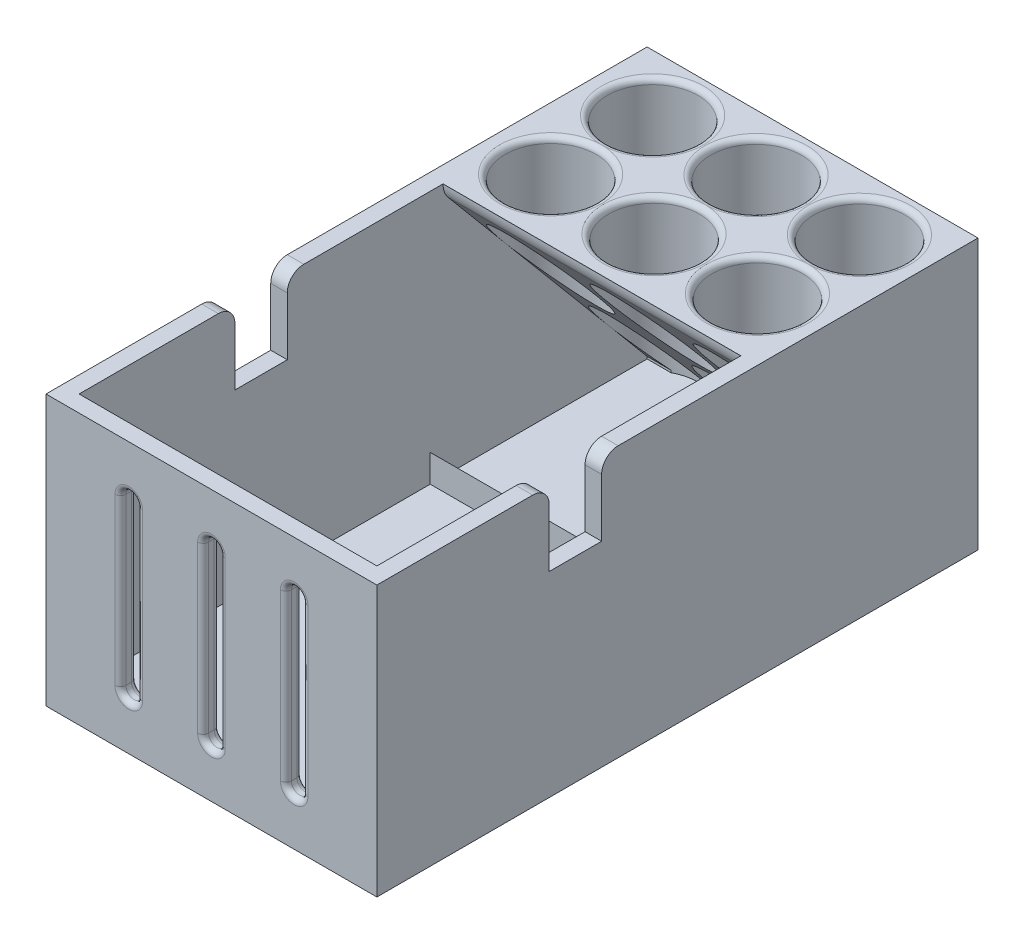
from build123d import *

# Parameters (mm, degrees)
BASE_PLATE_W              = 60
BASE_PLATE_H              = 106
BASE_DEPTH                = 3
SKETCH3_W                 = 3
SKETCH3_H                 = 106
BOSS_EXTRUDE2_DEPTH       = 46
SKETCH5_W                 = 54
SKETCH5_H                 = 3
BOSS_EXTRUDE3_DEPTH       = 46
SKETCH4_W                 = 54
SKETCH4_H                 = 37
BOSS_EXTRUDE4_DEPTH       = 1.5
BOSS_EXTRUDE5_DEPTH       = 54
CUT_EXTRUDE1_REACH        = 80.166
FLUXPENS_R                = 8.25
FILLET1_R                 = 1
FILLET2_R                 = 1
FILLET3_R                 = 1
FILLET4_R                 = 1
FILLET5_R                 = 1
FILLET6_R                 = 1
ROLLER_CUT_OUT_DEPTH      = 92.972822073
ROLLER_CUT_OUT_DEPTH_BACK = 92.972822073
SKETCH12_W                = 9.5
SKETCH12_H                = 13.5
SKETCH13_W                = 60
SKETCH13_H                = 49
BOSS_EXTRUDE6_DEPTH       = 3
CUT_EXTRUDE6_DEPTH        = 3
FILLET7_R                 = 1
FILLET8_R                 = 1
FILLET9_R                 = 1
FILLET10_R                = 3
FILLET11_R                = 3
FILLET12_R                = 3
FILLET13_R                = 3
FILLET14_R                = 4
FILLET15_R                = 1
FILLET16_R                = 1
FILLET17_R                = 1
TOOL_CATCHER_DEPTH        = 54


with BuildPart() as part:
    # Base Plate → Base (new body)
    with BuildSketch(Plane(origin=(0, 0, 0), x_dir=(1, 0, 0), z_dir=(0, 1, 0))):
        Rectangle(BASE_PLATE_W, BASE_PLATE_H)
    extrude(amount=BASE_DEPTH)

    # Sketch3 → Boss-Extrude2 (add)
    with BuildSketch(Plane(origin=(0, 3, 0), x_dir=(1, 0, 0), z_dir=(0, 1, 0))):
        with Locations((-28.5, 0)):
            Rectangle(SKETCH3_W, SKETCH3_H)
        with Locations((28.5, 0)):
            Rectangle(SKETCH3_W, SKETCH3_H)
    extrude(amount=BOSS_EXTRUDE2_DEPTH)

    # Sketch5 → Boss-Extrude3 (add)
    with BuildSketch(Plane(origin=(0, 3, 0), x_dir=(1, 0, 0), z_dir=(0, 1, 0))):
        with Locations((0, 51.5)):
            Rectangle(SKETCH5_W, SKETCH5_H)
    extrude(amount=BOSS_EXTRUDE3_DEPTH)

    # Sketch4 → Boss-Extrude4 (add)
    with BuildSketch(Plane(origin=(0, 49, 0), x_dir=(1, 0, 0), z_dir=(0, 1, 0))):
        with Locations((0, 31.5)):
            Rectangle(SKETCH4_W, SKETCH4_H)
    extrude(amount=-BOSS_EXTRUDE4_DEPTH)

    # Sketch7 → Boss-Extrude5 (add)
    with BuildSketch(Plane.ZY.offset(-27)):
        Polygon((-50, 47.5), (-13, 47.5), (-50, 3.405117074), align=None)
    extrude(amount=BOSS_EXTRUDE5_DEPTH)

    # Cut-Extrude1: up to this face of the body (flat: up to its plane)
    cut_extrude1_end = Plane(part.part.faces().sort_by_distance((0, 3, 1.5))[0])
    # FluxPens → Cut-Extrude1 (cut, up to the picked face)
    with BuildSketch(Plane(origin=(0, 49, 0), x_dir=(1, 0, 0), z_dir=(0, 1, 0)), mode=Mode.PRIVATE) as cut_extrude1_sk1:
        with Locations(Location((-18.75, 42.75, 0), (0, 0, 270))):
            Circle(FLUXPENS_R)
    cut_extrude1_tool1 = split(extrude(cut_extrude1_sk1.sketch, amount=-CUT_EXTRUDE1_REACH, mode=Mode.PRIVATE), bisect_by=cut_extrude1_end, keep=Keep.BOTH, mode=Mode.PRIVATE)
    # FluxPens → Cut-Extrude1 (cut, up to the picked face)
    with BuildSketch(Plane(origin=(0, 49, 0), x_dir=(1, 0, 0), z_dir=(0, 1, 0)), mode=Mode.PRIVATE) as cut_extrude1_sk2:
        with Locations(Location((-18.75, 24.25, 0), (0, 0, 270))):
            Circle(FLUXPENS_R)
    cut_extrude1_tool2 = split(extrude(cut_extrude1_sk2.sketch, amount=-CUT_EXTRUDE1_REACH, mode=Mode.PRIVATE), bisect_by=cut_extrude1_end, keep=Keep.BOTH, mode=Mode.PRIVATE)
    # FluxPens → Cut-Extrude1 (cut, up to the picked face)
    with BuildSketch(Plane(origin=(0, 49, 0), x_dir=(1, 0, 0), z_dir=(0, 1, 0)), mode=Mode.PRIVATE) as cut_extrude1_sk3:
        with Locations(Location((0, 42.75, 0), (0, 0, 270))):
            Circle(FLUXPENS_R)
    cut_extrude1_tool3 = split(extrude(cut_extrude1_sk3.sketch, amount=-CUT_EXTRUDE1_REACH, mode=Mode.PRIVATE), bisect_by=cut_extrude1_end, keep=Keep.BOTH, mode=Mode.PRIVATE)
    # FluxPens → Cut-Extrude1 (cut, up to the picked face)
    with BuildSketch(Plane(origin=(0, 49, 0), x_dir=(1, 0, 0), z_dir=(0, 1, 0)), mode=Mode.PRIVATE) as cut_extrude1_sk4:
        with Locations(Location((0, 24.25, 0), (0, 0, 270))):
            Circle(FLUXPENS_R)
    cut_extrude1_tool4 = split(extrude(cut_extrude1_sk4.sketch, amount=-CUT_EXTRUDE1_REACH, mode=Mode.PRIVATE), bisect_by=cut_extrude1_end, keep=Keep.BOTH, mode=Mode.PRIVATE)
    # FluxPens → Cut-Extrude1 (cut, up to the picked face)
    with BuildSketch(Plane(origin=(0, 49, 0), x_dir=(1, 0, 0), z_dir=(0, 1, 0)), mode=Mode.PRIVATE) as cut_extrude1_sk5:
        with Locations(Location((18.75, 24.25, 0), (0, 0, 270))):
            Circle(FLUXPENS_R)
    cut_extrude1_tool5 = split(extrude(cut_extrude1_sk5.sketch, amount=-CUT_EXTRUDE1_REACH, mode=Mode.PRIVATE), bisect_by=cut_extrude1_end, keep=Keep.BOTH, mode=Mode.PRIVATE)
    # FluxPens → Cut-Extrude1 (cut, up to the picked face)
    with BuildSketch(Plane(origin=(0, 49, 0), x_dir=(1, 0, 0), z_dir=(0, 1, 0)), mode=Mode.PRIVATE) as cut_extrude1_sk6:
        with Locations(Location((18.75, 42.75, 0), (0, 0, 270))):
            Circle(FLUXPENS_R)
    cut_extrude1_tool6 = split(extrude(cut_extrude1_sk6.sketch, amount=-CUT_EXTRUDE1_REACH, mode=Mode.PRIVATE), bisect_by=cut_extrude1_end, keep=Keep.BOTH, mode=Mode.PRIVATE)
    add(cut_extrude1_tool1.solids().sort_by(Axis((-18.75, 49, -42.75), (0, -1, 0)))[0], mode=Mode.SUBTRACT)
    add(cut_extrude1_tool2.solids().sort_by(Axis((-18.75, 49, -24.25), (0, -1, 0)))[0], mode=Mode.SUBTRACT)
    add(cut_extrude1_tool3.solids().sort_by(Axis((0, 49, -42.75), (0, -1, 0)))[0], mode=Mode.SUBTRACT)
    add(cut_extrude1_tool4.solids().sort_by(Axis((0, 49, -24.25), (0, -1, 0)))[0], mode=Mode.SUBTRACT)
    add(cut_extrude1_tool5.solids().sort_by(Axis((18.75, 49, -24.25), (0, -1, 0)))[0], mode=Mode.SUBTRACT)
    add(cut_extrude1_tool6.solids().sort_by(Axis((18.75, 49, -42.75), (0, -1, 0)))[0], mode=Mode.SUBTRACT)

    # Fillet1
    fillet1_edges = [part.edges().sort_by_distance(p)[0] for p in [
        (-18.75, 49, -51),
    ]]
    fillet(fillet1_edges, radius=FILLET1_R)

    # Fillet2
    fillet2_edges = [part.edges().sort_by_distance(p)[0] for p in [
        (0, 49, -51),
    ]]
    fillet(fillet2_edges, radius=FILLET2_R)

    # Fillet3
    fillet3_edges = [part.edges().sort_by_distance(p)[0] for p in [
        (-18.75, 49, -32.5),
    ]]
    fillet(fillet3_edges, radius=FILLET3_R - 0.0001)  # a hair under: the kernel refuses the full size

    # Fillet4
    fillet4_edges = [part.edges().sort_by_distance(p)[0] for p in [
        (0, 49, -32.5),
    ]]
    fillet(fillet4_edges, radius=FILLET4_R - 0.0001)  # a hair under: the kernel refuses the full size

    # Fillet5
    fillet5_edges = [part.edges().sort_by_distance(p)[0] for p in [
        (18.75, 49, -51),
    ]]
    fillet(fillet5_edges, radius=FILLET5_R)

    # Fillet6
    fillet6_edges = [part.edges().sort_by_distance(p)[0] for p in [
        (18.75, 49, -32.5),
    ]]
    fillet(fillet6_edges, radius=FILLET6_R - 0.0001)  # a hair under: the kernel refuses the full size

    # Sketch12 → Roller Cut Out (cut, two sides: drawn at the far end of the back side and taken through both)
    with BuildSketch(Plane(origin=(-27, 0, 0), x_dir=(0, 0, -1), z_dir=(1, 0, 0)).offset(-ROLLER_CUT_OUT_DEPTH_BACK)):
        with Locations((-20, 42.25)):
            Rectangle(SKETCH12_W, SKETCH12_H)
    extrude(amount=ROLLER_CUT_OUT_DEPTH + ROLLER_CUT_OUT_DEPTH_BACK, mode=Mode.SUBTRACT)

    # Sketch13 → Boss-Extrude6 (add)
    with BuildSketch(Plane.XY.offset(53)):
        with Locations((0, 24.5)):
            Rectangle(SKETCH13_W, SKETCH13_H)
    extrude(amount=BOSS_EXTRUDE6_DEPTH)

    # Sketch14 → Cut-Extrude6 (cut)
    with BuildSketch(Plane.XY.offset(56)):
        with BuildLine():
            Line((-16.5, 9.5), (-16.5, 39.5))
            ThreePointArc((-16.5, 39.5), (-15, 41), (-13.5, 39.5))
            Line((-13.5, 39.5), (-13.5, 9.5))
            ThreePointArc((-13.5, 9.5), (-15, 8), (-16.5, 9.5))
        make_face()
        with BuildLine():
            Line((13.5, 9.5), (13.5, 39.5))
            ThreePointArc((13.5, 39.5), (15, 41), (16.5, 39.5))
            Line((16.5, 39.5), (16.5, 9.5))
            ThreePointArc((16.5, 9.5), (15, 8), (13.5, 9.5))
        make_face()
        with BuildLine():
            Line((-1.5, 39.5), (-1.5, 9.5))
            ThreePointArc((-1.5, 9.5), (0, 8), (1.5, 9.5))
            Line((1.5, 9.5), (1.5, 39.5))
            ThreePointArc((1.5, 39.5), (0, 41), (-1.5, 39.5))
        make_face()
    extrude(amount=-CUT_EXTRUDE6_DEPTH, mode=Mode.SUBTRACT)

    # Fillet7
    fillet7_edges = [part.edges().sort_by_distance(p)[0] for p in [
        (-15, 8, 53),
        (-16.5, 24.5, 53),
        (-15, 41, 53),
        (-13.5, 24.5, 53),
    ]]
    fillet(fillet7_edges, radius=FILLET7_R)

    # Fillet8
    fillet8_edges = [part.edges().sort_by_distance(p)[0] for p in [
        (0, 41, 53),
        (1.5, 24.5, 53),
        (0, 8, 53),
        (-1.5, 24.5, 53),
    ]]
    fillet(fillet8_edges, radius=FILLET8_R)

    # Fillet9
    fillet9_edges = [part.edges().sort_by_distance(p)[0] for p in [
        (15, 8, 53),
        (13.5, 24.5, 53),
        (15, 41, 53),
        (16.5, 24.5, 53),
    ]]
    fillet(fillet9_edges, radius=FILLET9_R)

    # Fillet10
    fillet10_edges = [part.edges().sort_by_distance(p)[0] for p in [
        (-28.5, 49, 15.25),
    ]]
    fillet(fillet10_edges, radius=FILLET10_R)

    # Fillet11
    fillet11_edges = [part.edges().sort_by_distance(p)[0] for p in [
        (-28.5, 49, 24.75),
    ]]
    fillet(fillet11_edges, radius=FILLET11_R)

    # Fillet12
    fillet12_edges = [part.edges().sort_by_distance(p)[0] for p in [
        (28.5, 49, 15.25),
    ]]
    fillet(fillet12_edges, radius=FILLET12_R)

    # Fillet13
    fillet13_edges = [part.edges().sort_by_distance(p)[0] for p in [
        (28.5, 49, 24.75),
    ]]
    fillet(fillet13_edges, radius=FILLET13_R)

    # Fillet14
    fillet14_edges = [part.edges().sort_by_distance(p)[0] for p in [
        (0, 47.5, -13),
    ]]
    fillet(fillet14_edges, radius=FILLET14_R)

    # Fillet15
    fillet15_edges = [part.edges().sort_by_distance(p)[0] for p in [
        (0, 41, 56),
        (-1.5, 24.5, 56),
        (0, 8, 56),
        (1.5, 24.5, 56),
    ]]
    fillet(fillet15_edges, radius=FILLET15_R)

    # Fillet16
    fillet16_edges = [part.edges().sort_by_distance(p)[0] for p in [
        (-15, 8, 56),
        (-13.5, 24.5, 56),
        (-15, 41, 56),
        (-16.5, 24.5, 56),
    ]]
    fillet(fillet16_edges, radius=FILLET16_R)

    # Fillet17
    fillet17_edges = [part.edges().sort_by_distance(p)[0] for p in [
        (15, 8, 56),
        (16.5, 24.5, 56),
        (15, 41, 56),
        (13.5, 24.5, 56),
    ]]
    fillet(fillet17_edges, radius=FILLET17_R)

    # Sketch16 → Tool Catcher (add)
    with BuildSketch(Plane(origin=(-27, 0, 0), x_dir=(0, 0, -1), z_dir=(1, 0, 0))):
        Polygon((10.668461709, 3), (10.668461709, 8), (13, 3), align=None)
    extrude(amount=TOOL_CATCHER_DEPTH)


solid = part.part
